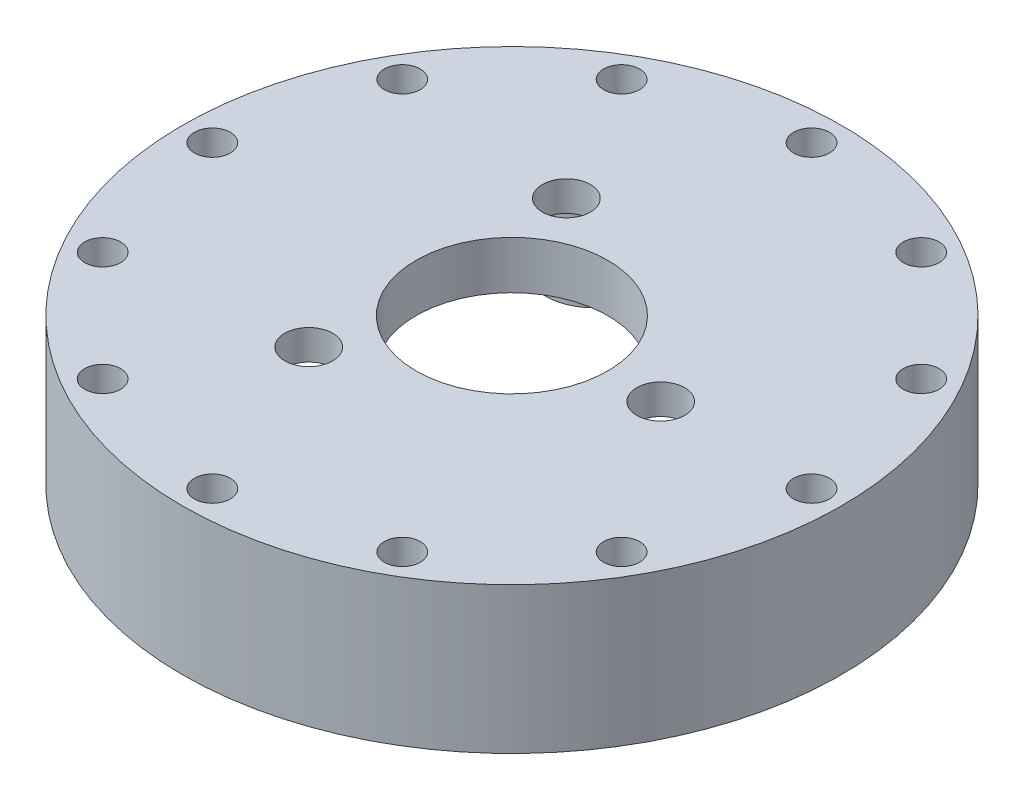
from build123d import *

# Parameters (mm, degrees)
SKETCH1_R           = 27.5
BOSS_EXTRUDE2_DEPTH = 8.2
SKETCH2_R           = 27.5
SKETCH2_R_2         = 8
SKETCH2_R_3         = 2
BOSS_EXTRUDE3_DEPTH = 4
FILLET2_R           = 1
SKETCH8_R           = 1.5
CUT_EXTRUDE1_DEPTH  = 41.759538896
SKETCH9_R           = 4.25
CUT_EXTRUDE2_DEPTH  = 1.5


with BuildPart() as part:
    # Sketch1 → Boss-Extrude2 (new body)
    with BuildSketch(Plane(origin=(0, 0, 0), x_dir=(1, 0, 0), z_dir=(0, 1, 0))):
        Circle(SKETCH1_R)
        with BuildLine():
            ThreePointArc((22.488576724, 0.716879998), (18.385933283, -2.643498121), (21.375662918, -7.023605541))
            ThreePointArc((21.375662918, -7.023605541), (20.466719895, -9.346837793), (19.306169205, -11.555164673))
            ThreePointArc((19.306169205, -11.555164673), (14.038048344, -12.164038133), (14.185104106, -17.465188849))
            ThreePointArc((14.185104106, -17.465188849), (12.164418393, -18.928204489), (9.994189375, -20.158526204))
            ThreePointArc((9.994189375, -20.158526204), (5.233182243, -17.822581985), (2.490874966, -22.3616981))
            ThreePointArc((2.490874966, -22.3616981), (0, -22.5), (-2.490874966, -22.3616981))
            ThreePointArc((-2.490874966, -22.3616981), (-5.233182243, -17.822581985), (-9.994189375, -20.158526204))
            ThreePointArc((-9.994189375, -20.158526204), (-12.164418393, -18.928204489), (-14.185104106, -17.465188849))
            ThreePointArc((-14.185104106, -17.465188849), (-14.038048344, -12.164038133), (-19.306169205, -11.555164673))
            ThreePointArc((-19.306169205, -11.555164673), (-20.466719895, -9.346837793), (-21.375662918, -7.023605541))
            ThreePointArc((-21.375662918, -7.023605541), (-18.385933283, -2.643498121), (-22.488576724, 0.716879998))
            ThreePointArc((-22.488576724, 0.716879998), (-22.270982442, 3.202083861), (-21.779599788, 5.647922899))
            ThreePointArc((-21.779599788, 5.647922899), (-16.896414314, 7.716333867), (-18.531020029, 12.761320334))
            ThreePointArc((-18.531020029, 12.761320334), (-17.004365423, 14.734366514), (-15.268667612, 16.526275725))
            ThreePointArc((-15.268667612, 16.526275725), (-10.042403184, 15.626284372), (-8.689995409, 20.754131632))
            ThreePointArc((-8.689995409, 20.754131632), (-6.338982529, 21.588591906), (-3.910041353, 22.157652778))
            ThreePointArc((-3.910041353, 22.157652778), (0, 18.575), (3.910041353, 22.157652778))
            ThreePointArc((3.910041353, 22.157652778), (6.338982529, 21.588591906), (8.689995409, 20.754131632))
            ThreePointArc((8.689995409, 20.754131632), (10.042403184, 15.626284372), (15.268667612, 16.526275725))
            ThreePointArc((15.268667612, 16.526275725), (17.004365423, 14.734366514), (18.531020029, 12.761320334))
            ThreePointArc((18.531020029, 12.761320334), (16.896414314, 7.716333867), (21.779599788, 5.647922899))
            ThreePointArc((21.779599788, 5.647922899), (22.270982442, 3.202083861), (22.488576724, 0.716879998))
        make_face(mode=Mode.SUBTRACT)
    extrude(amount=BOSS_EXTRUDE2_DEPTH)

    # Sketch2 → Boss-Extrude3 (add)
    with BuildSketch(Plane(origin=(0, 8.2, 0), x_dir=(1, 0, 0), z_dir=(0, 1, 0))):
        Circle(SKETCH2_R)
        Circle(SKETCH2_R_2, mode=Mode.SUBTRACT)
        with Locations((-6.206515394, 10.75)):
            Circle(SKETCH2_R_3, mode=Mode.SUBTRACT)
        with Locations((12.413030788, 0)):
            Circle(SKETCH2_R_3, mode=Mode.SUBTRACT)
        with Locations((-6.206515394, -10.75)):
            Circle(SKETCH2_R_3, mode=Mode.SUBTRACT)
    extrude(amount=BOSS_EXTRUDE3_DEPTH)

    # Fillet2
    fillet2_edges = [part.edges().sort_by_distance(p)[0] for p in [
        (19.306169205, 4.1, 11.555164673),
        (9.994189375, 4.1, 20.158526204),
        (2.490874966, 4.1, 22.3616981),
        (14.185104106, 4.1, 17.465188849),
        (-2.490874966, 4.1, 22.3616981),
        (-9.994189375, 4.1, 20.158526204),
        (-14.185104106, 4.1, 17.465188849),
        (-19.306169205, 4.1, 11.555164673),
        (-21.375662918, 4.1, 7.023605541),
        (-22.488576724, 4.1, -0.716879998),
        (-21.779599788, 4.1, -5.647922899),
        (-18.531020029, 4.1, -12.761320334),
        (-15.268667612, 4.1, -16.526275725),
        (-8.689995409, 4.1, -20.754131632),
        (-3.910041353, 4.1, -22.157652778),
        (3.910041353, 4.1, -22.157652778),
        (8.689995409, 4.1, -20.754131632),
        (15.268667612, 4.1, -16.526275725),
        (18.531020029, 4.1, -12.761320334),
        (21.779599788, 4.1, -5.647922899),
        (22.488576724, 4.1, -0.716879998),
        (21.375662918, 4.1, 7.023605541),
    ]]
    fillet(fillet2_edges, radius=FILLET2_R)

    # Sketch8 → Cut-Extrude1 (cut, through all)
    with BuildSketch(Plane.XZ):
        with Locations((0, -25)):
            Circle(SKETCH8_R)
        with Locations((-12.5, -21.650635095)):
            Circle(SKETCH8_R)
        with Locations((-21.650635095, -12.5)):
            Circle(SKETCH8_R)
        with Locations((-25, 0)):
            Circle(SKETCH8_R)
        with Locations((-21.650635095, 12.5)):
            Circle(SKETCH8_R)
        with Locations((-12.5, 21.650635095)):
            Circle(SKETCH8_R)
        with Locations((0, 25)):
            Circle(SKETCH8_R)
        with Locations((12.5, 21.650635095)):
            Circle(SKETCH8_R)
        with Locations((21.650635095, 12.5)):
            Circle(SKETCH8_R)
        with Locations((25, 0)):
            Circle(SKETCH8_R)
        with Locations((21.650635095, -12.5)):
            Circle(SKETCH8_R)
        with Locations((12.5, -21.650635095)):
            Circle(SKETCH8_R)
    extrude(amount=-CUT_EXTRUDE1_DEPTH, mode=Mode.SUBTRACT)

    # Sketch9 → Cut-Extrude2 (cut)
    with BuildSketch(Plane.XZ.offset(-8.2)):
        with Locations((12.413030788, 0)):
            Circle(SKETCH9_R)
        with Locations((-6.206515394, -10.75)):
            Circle(SKETCH9_R)
        with Locations((-6.206515394, 10.75)):
            Circle(SKETCH9_R)
    extrude(amount=-CUT_EXTRUDE2_DEPTH, mode=Mode.SUBTRACT)


solid = part.part
